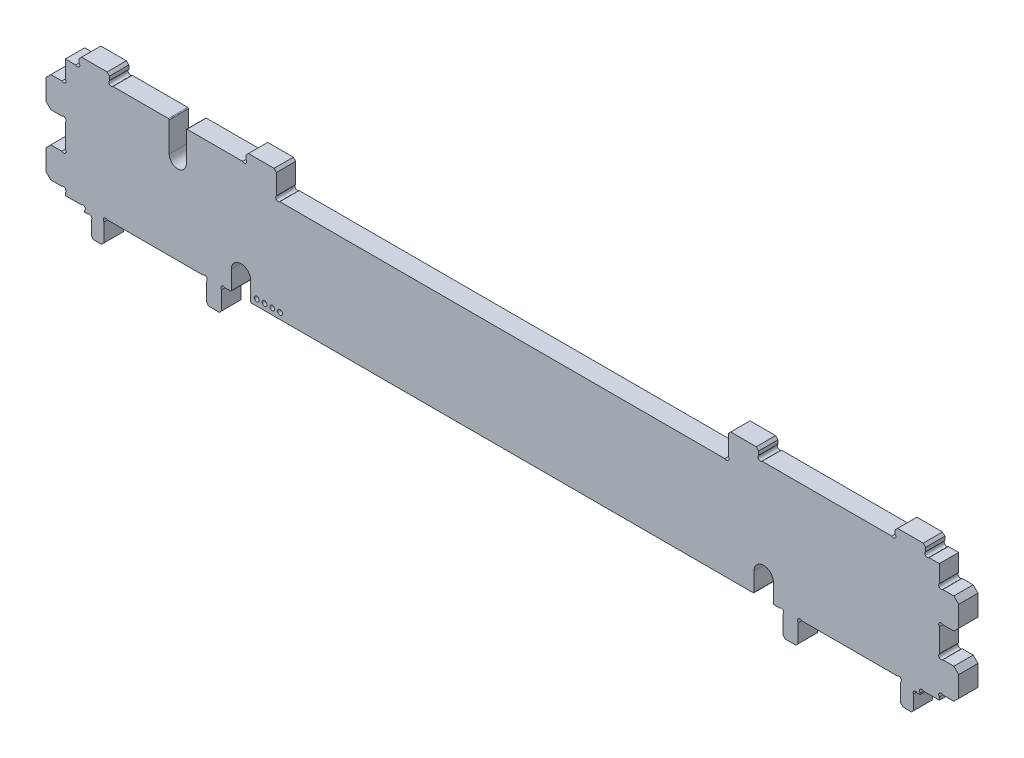
from build123d import *

# Parameters (mm, degrees)
BOSS_EXTRUDE1_DEPTH = 6.35
CUT_EXTRUDE2_DEPTH  = 169.008101823
CUT_EXTRUDE3_DEPTH  = 169.008101823
CUT_EXTRUDE4_DEPTH  = 169.008101823
FILLET1_R           = 0.254
SKETCH7_R           = 0.79375
CUT_EXTRUDE5_DEPTH  = 2.54
LPATTERN1_COUNT     = 4
LPATTERN1_PITCH     = 2.54


with BuildPart() as part:
    # Model → Boss-Extrude1 (new body)
    with BuildSketch(Plane.XY):
        with BuildLine():
            Line((138.15521867, -67.612541882), (138.94896867, -66.818791882))
            Line((138.94896867, -66.818791882), (138.94896867, -62.385073899))
            ThreePointArc((138.94896867, -62.385073899), (138.948968669, -61.262541883), (140.071500684, -61.262541882))
            Line((140.071500684, -61.262541882), (140.971545702, -61.262541882))
            Line((140.971545702, -61.262541882), (140.971545702, -60.810273899))
            ThreePointArc((140.971545702, -60.810273899), (140.9715457, -59.687741883), (142.094077716, -59.687741882))
            Line((142.094077716, -59.687741882), (147.321545702, -59.687741882))
            Line((147.321545702, -59.687741882), (147.321545702, -58.735073899))
            ThreePointArc((147.321545702, -58.735073899), (147.3215457, -57.612541883), (148.444077716, -57.612541882))
            Line((148.444077716, -57.612541882), (152.084045702, -57.612541882))
            Line((152.084045702, -57.612541882), (153.671545702, -56.025041882))
            Line((153.671545702, -56.025041882), (153.671545702, -49.200041882))
            Line((153.671545702, -49.200041882), (152.084045702, -47.612541882))
            Line((152.084045702, -47.612541882), (148.444077716, -47.612541882))
            ThreePointArc((148.444077716, -47.612541882), (147.321545702, -47.612541882), (147.321545702, -46.490009867))
            Line((147.321545702, -46.490009867), (147.321545702, -38.735073899))
            ThreePointArc((147.321545702, -38.735073899), (147.3215457, -37.612541883), (148.444077716, -37.612541882))
            Line((148.444077716, -37.612541882), (152.084045702, -37.612541882))
            Line((152.084045702, -37.612541882), (153.671545702, -36.025041882))
            Line((153.671545702, -36.025041882), (153.671545702, -29.200041882))
            Line((153.671545702, -29.200041882), (152.084045702, -27.612541882))
            Line((152.084045702, -27.612541882), (148.444077716, -27.612541882))
            ThreePointArc((148.444077716, -27.612541882), (147.321545702, -27.612541882), (147.321545702, -26.490009867))
            Line((147.321545702, -26.490009867), (147.321545702, -20.787541882))
            Line((147.321545702, -20.787541882), (143.919077716, -20.787541882))
            ThreePointArc((143.919077716, -20.787541882), (142.796545702, -20.787541882), (142.796545702, -19.665009867))
            Line((142.796545702, -19.665009867), (142.796545702, -18.406291882))
            Line((142.796545702, -18.406291882), (142.002795702, -17.612541882))
            Line((142.002795702, -17.612541882), (133.590295702, -17.612541882))
            Line((133.590295702, -17.612541882), (132.796545702, -18.406291882))
            Line((132.796545702, -18.406291882), (132.796545702, -19.665009867))
            ThreePointArc((132.796545702, -19.665009867), (132.796545702, -20.787541882), (131.674013687, -20.787541882))
            Line((131.674013687, -20.787541882), (89.055077716, -20.787541882))
            ThreePointArc((89.055077716, -20.787541882), (87.932545702, -20.787541882), (87.932545702, -19.665009867))
            Line((87.932545702, -19.665009867), (87.932545702, -18.406291882))
            Line((87.932545702, -18.406291882), (87.138795702, -17.612541882))
            Line((87.138795702, -17.612541882), (78.726295702, -17.612541882))
            Line((78.726295702, -17.612541882), (77.932545702, -18.406291882))
            Line((77.932545702, -18.406291882), (77.932545702, -25.037209867))
            ThreePointArc((77.932545702, -25.037209867), (77.932545702, -26.159741882), (76.810013687, -26.159741882))
            Line((76.810013687, -26.159741882), (-69.46692228, -26.159741882))
            ThreePointArc((-69.46692228, -26.159741882), (-70.589454296, -26.159741883), (-70.589454297, -25.037209867))
            Line((-70.589454297, -25.037209867), (-70.589454297, -18.406291882))
            Line((-70.589454297, -18.406291882), (-71.383204297, -17.612541882))
            Line((-71.383204297, -17.612541882), (-79.795704297, -17.612541882))
            Line((-79.795704297, -17.612541882), (-80.589454297, -18.406291882))
            Line((-80.589454297, -18.406291882), (-80.589454297, -19.665009867))
            ThreePointArc((-80.589454297, -19.665009867), (-80.589454297, -20.787541882), (-81.711986312, -20.787541882))
            Line((-81.711986312, -20.787541882), (-100.521454296, -20.787541882))
            Line((-100.521454296, -20.787541882), (-100.521454296, -29.665009867))
            ThreePointArc((-100.521454296, -29.665009867), (-100.521454296, -30.787541882), (-101.64398631, -30.787541882))
            Line((-101.64398631, -30.787541882), (-104.398922281, -30.787541882))
            ThreePointArc((-104.398922281, -30.787541882), (-105.521454296, -30.787541882), (-105.521454296, -29.665009867))
            Line((-105.521454296, -29.665009867), (-105.521454296, -20.787541882))
            Line((-105.521454296, -20.787541882), (-124.33092228, -20.787541882))
            ThreePointArc((-124.33092228, -20.787541882), (-125.453454296, -20.787541883), (-125.453454297, -19.665009867))
            Line((-125.453454297, -19.665009867), (-125.453454297, -18.406291882))
            Line((-125.453454297, -18.406291882), (-126.247204297, -17.612541882))
            Line((-126.247204297, -17.612541882), (-134.659704297, -17.612541882))
            Line((-134.659704297, -17.612541882), (-135.453454297, -18.406291882))
            Line((-135.453454297, -18.406291882), (-135.453454297, -19.665009867))
            ThreePointArc((-135.453454297, -19.665009867), (-135.453454297, -20.787541882), (-136.575986312, -20.787541882))
            Line((-136.575986312, -20.787541882), (-139.978454297, -20.787541882))
            Line((-139.978454297, -20.787541882), (-139.978454297, -26.490009867))
            ThreePointArc((-139.978454297, -26.490009867), (-139.978454297, -27.612541882), (-141.100986312, -27.612541882))
            Line((-141.100986312, -27.612541882), (-144.740954297, -27.612541882))
            Line((-144.740954297, -27.612541882), (-146.328454297, -29.200041882))
            Line((-146.328454297, -29.200041882), (-146.328454297, -36.025041882))
            Line((-146.328454297, -36.025041882), (-144.740954297, -37.612541882))
            Line((-144.740954297, -37.612541882), (-141.100986312, -37.612541882))
            ThreePointArc((-141.100986312, -37.612541882), (-139.978454296, -37.612541883), (-139.978454297, -38.735073899))
            Line((-139.978454297, -38.735073899), (-139.978454297, -46.490009867))
            ThreePointArc((-139.978454297, -46.490009867), (-139.978454297, -47.612541882), (-141.100986312, -47.612541882))
            Line((-141.100986312, -47.612541882), (-144.740954297, -47.612541882))
            Line((-144.740954297, -47.612541882), (-146.328454297, -49.200041882))
            Line((-146.328454297, -49.200041882), (-146.328454297, -56.025041882))
            Line((-146.328454297, -56.025041882), (-144.740954297, -57.612541882))
            Line((-144.740954297, -57.612541882), (-141.100986312, -57.612541882))
            ThreePointArc((-141.100986312, -57.612541882), (-139.978454296, -57.612541883), (-139.978454297, -58.735073899))
            Line((-139.978454297, -58.735073899), (-139.978454297, -59.687741882))
            Line((-139.978454297, -59.687741882), (-134.750986312, -59.687741882))
            ThreePointArc((-134.750986312, -59.687741882), (-133.628454296, -59.687741883), (-133.628454297, -60.810273899))
            Line((-133.628454297, -60.810273899), (-133.628454297, -61.262541882))
            Line((-133.628454297, -61.262541882), (-132.630226339, -61.262541882))
            ThreePointArc((-132.630226339, -61.262541882), (-131.507694322, -61.262541882), (-131.507694322, -62.385073899))
            Line((-131.507694322, -62.385073899), (-131.507694322, -66.818791882))
            Line((-131.507694322, -66.818791882), (-130.713944322, -67.612541882))
            Line((-130.713944322, -67.612541882), (-128.072204297, -67.612541882))
            Line((-128.072204297, -67.612541882), (-127.278454297, -66.818791882))
            Line((-127.278454297, -66.818791882), (-127.278454297, -60.810273899))
            ThreePointArc((-127.278454297, -60.810273899), (-127.278454298, -59.687741883), (-126.155922283, -59.687741882))
            Line((-126.155922283, -59.687741882), (-94.70598631, -59.687741882))
            ThreePointArc((-94.70598631, -59.687741882), (-93.583454294, -59.687741883), (-93.583454296, -60.810273899))
            Line((-93.583454296, -60.810273899), (-93.583454296, -66.818791882))
            Line((-93.583454296, -66.818791882), (-92.789704296, -67.612541882))
            Line((-92.789704296, -67.612541882), (-89.377204296, -67.612541882))
            Line((-89.377204296, -67.612541882), (-88.583454296, -66.818791882))
            Line((-88.583454296, -66.818791882), (-88.583454296, -60.810273899))
            ThreePointArc((-88.583454296, -60.810273899), (-88.583454297, -59.687741883), (-87.460922281, -59.687741882))
            Line((-87.460922281, -59.687741882), (94.804013689, -59.687741882))
            ThreePointArc((94.804013689, -59.687741882), (95.926545704, -59.687741883), (95.926545703, -60.810273899))
            Line((95.926545703, -60.810273899), (95.926545703, -66.818791882))
            Line((95.926545703, -66.818791882), (96.720295703, -67.612541882))
            Line((96.720295703, -67.612541882), (100.132795703, -67.612541882))
            Line((100.132795703, -67.612541882), (100.926545703, -66.818791882))
            Line((100.926545703, -66.818791882), (100.926545703, -60.810273899))
            ThreePointArc((100.926545703, -60.810273899), (100.926545702, -59.687741883), (102.049077718, -59.687741882))
            Line((102.049077718, -59.687741882), (133.499013687, -59.687741882))
            ThreePointArc((133.499013687, -59.687741882), (134.621545703, -59.687741883), (134.621545702, -60.810273899))
            Line((134.621545702, -60.810273899), (134.621545702, -66.818791882))
            Line((134.621545702, -66.818791882), (135.415295702, -67.612541882))
            Line((135.415295702, -67.612541882), (138.15521867, -67.612541882))
        make_face()
    extrude(amount=BOSS_EXTRUDE1_DEPTH)

    # Sketch3 → Cut-Extrude2 (cut, through all)
    with BuildSketch(Plane.XY.offset(6.35)):
        with BuildLine():
            Line((-131.355294322, -62.171255574), (-131.355294322, -66.971191882))
            Line((-131.355294322, -66.971191882), (-131.507694322, -66.818791882))
            Line((-131.507694322, -66.818791882), (-131.507694322, -62.385073899))
            ThreePointArc((-131.507694322, -62.385073899), (-131.422591643, -62.284510162), (-131.355294322, -62.171255574))
        make_face()
        with BuildLine():
            Line((138.79656867, -62.171255574), (138.79656867, -66.971191882))
            Line((138.79656867, -66.971191882), (138.94896867, -66.818791882))
            Line((138.94896867, -66.818791882), (138.94896867, -62.385073899))
            ThreePointArc((138.94896867, -62.385073899), (138.86386599, -62.284510163), (138.79656867, -62.171255574))
        make_face()
    extrude(amount=-CUT_EXTRUDE2_DEPTH, mode=Mode.SUBTRACT)

    # Sketch4 → Cut-Extrude3 (cut, through all)
    with BuildSketch(Plane.XY.offset(6.35)):
        with BuildLine():
            Line((-85.408454296, -59.687741882), (-79.058454296, -59.687741882))
            Line((-79.058454296, -59.687741882), (-79.058454296, -53.337741882))
            ThreePointArc((-79.058454296, -53.337741882), (-82.233454296, -50.162741882), (-85.408454296, -53.337741882))
            Line((-85.408454296, -53.337741882), (-85.408454296, -59.687741882))
        make_face()
        with BuildLine():
            Line((86.4015457, -59.687741882), (86.4015457, -53.337741882))
            ThreePointArc((86.4015457, -53.337741882), (89.5765457, -50.162741882), (92.751545701, -53.337741882))
            Line((92.751545701, -53.337741882), (92.751545701, -59.687741882))
            Line((92.751545701, -59.687741882), (86.4015457, -59.687741882))
        make_face()
    extrude(amount=-CUT_EXTRUDE3_DEPTH, mode=Mode.SUBTRACT)

    # Sketch6 → Cut-Extrude4 (cut, through all)
    with BuildSketch(Plane.XY.offset(6.35)):
        with BuildLine():
            Line((-105.833547434, -30.787541882), (-105.833547434, -20.787541882))
            Line((-105.833547434, -20.787541882), (-100.209361158, -20.787541882))
            Line((-100.209361158, -20.787541882), (-100.209361158, -30.787541882))
            ThreePointArc((-100.209361158, -30.787541882), (-103.021454296, -33.59963502), (-105.833547434, -30.787541882))
        make_face()
    extrude(amount=-CUT_EXTRUDE4_DEPTH, mode=Mode.SUBTRACT)

    # Fillet1
    fillet1_edges = [part.edges().sort_by_distance(p)[0] for p in [
        (86.4015457, -59.687741882, 3.175),
        (92.751545701, -59.687741882, 3.175),
        (-79.058454296, -59.687741882, 3.175),
        (-85.408454296, -59.687741882, 3.175),
        (-105.833547434, -20.787541882, 3.175),
        (-100.209361158, -20.787541882, 3.175),
    ]]
    fillet(fillet1_edges, radius=FILLET1_R)

    # Sketch7 → Cut-Extrude5 (cut)
    with BuildSketch(Plane.XY.offset(6.35)):
        with Locations((-77.026454296, -57.655741882)):
            Circle(SKETCH7_R)
    cut_extrude5 = extrude(amount=-CUT_EXTRUDE5_DEPTH, mode=Mode.SUBTRACT)

    # LPattern1: Cut-Extrude5 ×4
    with Locations(*[(i * LPATTERN1_PITCH, 0, 0) for i in range(1, LPATTERN1_COUNT)]):
        add(cut_extrude5, mode=Mode.SUBTRACT)


solid = part.part
